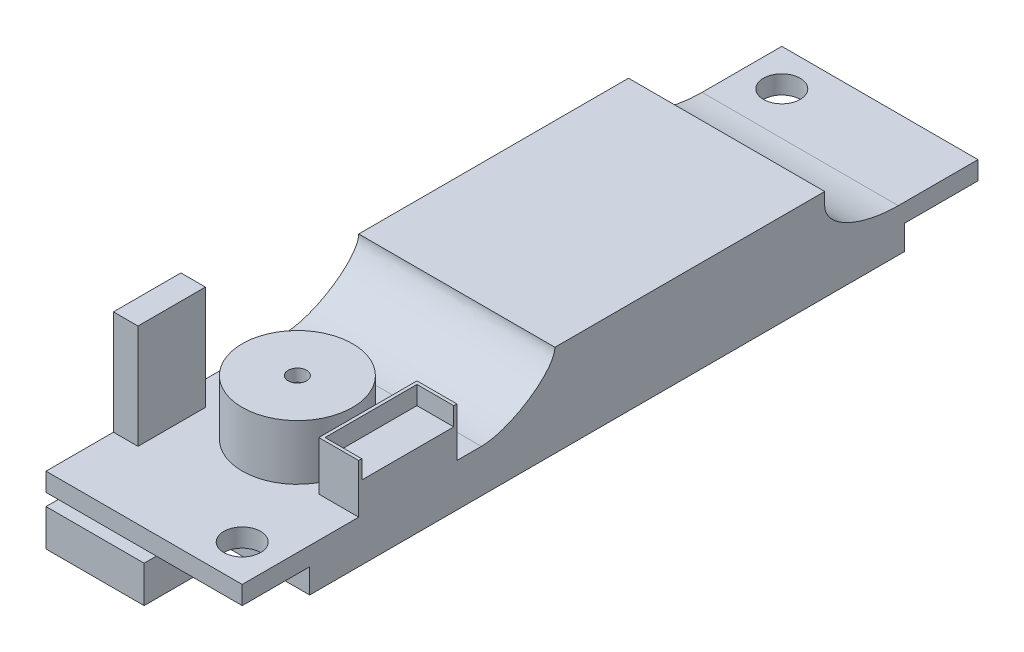
from build123d import *

# Parameters (mm, degrees)
SKETCH1_W           = 16
SKETCH1_H           = 60
BOSS_EXTRUDE1_DEPTH = 1.5
SKETCH5_R           = 1.5
CUT_EXTRUDE1_DEPTH  = 32.084562085
SKETCH8_W           = 16
SKETCH8_H           = 22
BOSS_EXTRUDE2_DEPTH = 4
FILLET1_START       = -8
FILLET1_DEPTH       = 16
FILLET2_START       = -8
FILLET2_DEPTH       = 16
SKETCH12_W          = 3.25
SKETCH12_H          = 8
BOSS_EXTRUDE5_DEPTH = 4
SKETCH15_R          = 4.5
BOSS_EXTRUDE6_DEPTH = 4.5
SKETCH16_W          = 3
SKETCH16_H          = 7.5
CUT_EXTRUDE2_DEPTH  = 1.5
SKETCH17_R          = 0.75
CUT_EXTRUDE3_DEPTH  = 1
SKETCH18_W          = 2
SKETCH18_H          = 5.5
BOSS_EXTRUDE7_DEPTH = 8.5
SKETCH22_W          = 8
SKETCH22_H          = 5.5
BOSS_EXTRUDE8_DEPTH = 3
SKETCH23_W          = 16
SKETCH23_H          = 48.5
BOSS_EXTRUDE9_DEPTH = 2


with BuildPart() as part:
    # Sketch1 → Boss-Extrude1 (new body)
    with BuildSketch(Plane(origin=(0, 0, 0), x_dir=(1, 0, 0), z_dir=(0, 1, 0))):
        Rectangle(SKETCH1_W, SKETCH1_H)
    extrude(amount=BOSS_EXTRUDE1_DEPTH)

    # Sketch5 → Cut-Extrude1 (cut, through all)
    with BuildSketch(Plane(origin=(0, 1.5, 0), x_dir=(1, 0, 0), z_dir=(0, 1, 0))):
        with Locations(Location((-5, 27, 0), (0, 0, 270))):
            Circle(SKETCH5_R)
        with Locations(Location((5, -27, 0), (0, 0, 270))):
            Circle(SKETCH5_R)
    extrude(amount=-CUT_EXTRUDE1_DEPTH, mode=Mode.SUBTRACT)

    # Sketch8 → Boss-Extrude2 (add)
    with BuildSketch(Plane(origin=(0, 1.5, 0), x_dir=(1, 0, 0), z_dir=(0, 1, 0))):
        with Locations((0, 6.5)):
            Rectangle(SKETCH8_W, SKETCH8_H)
    extrude(amount=BOSS_EXTRUDE2_DEPTH)

    # Fillet1: read off the stored shape, not the designer's step
    # Fillet1 outline → Fillet1 (add)
    with BuildSketch(Plane.YZ.offset(FILLET1_START)):
        with BuildLine():
            Line((1.5, -17.5), (1.5, -23.5))
            add(Edge.make_bspline(
                [(1.5, -23.5), (1.5, -17.5), (4.5, -17.5)],
                knots=[0, 0, 0, 1, 1, 1], degree=2, weights=[1, 0.666666667, 1]))
            Line((4.5, -17.5), (1.5, -17.5))
        make_face()
    extrude(amount=FILLET1_DEPTH)

    # Fillet2: read off the stored shape, not the designer's step
    # Fillet2 outline → Fillet2 (add)
    with BuildSketch(Plane.YZ.offset(FILLET2_START)):
        with BuildLine():
            Line((1.5, 4.5), (5.5, 4.5))
            add(Edge.make_bspline(
                [(5.5, 4.5), (1.5, 4.5), (1.5, 10.5)],
                knots=[0, 0, 0, 1, 1, 1], degree=2, weights=[1, 0.428571429, 1]))
            Line((1.5, 10.5), (1.5, 4.5))
        make_face()
    extrude(amount=FILLET2_DEPTH)

    # Sketch12 → Boss-Extrude5 (add)
    with BuildSketch(Plane(origin=(0, 1.5, 0), x_dir=(1, 0, 0), z_dir=(0, 1, 0))):
        with Locations((6.375, -16.5)):
            Rectangle(SKETCH12_W, SKETCH12_H)
    extrude(amount=BOSS_EXTRUDE5_DEPTH)

    # Sketch15 → Boss-Extrude6 (add)
    with BuildSketch(Plane(origin=(0, 1.5, 0), x_dir=(1, 0, 0), z_dir=(0, 1, 0))):
        with Locations(Location((0, -17.5, 0), (0, 0, 270))):
            Circle(SKETCH15_R)
    extrude(amount=BOSS_EXTRUDE6_DEPTH)

    # Sketch16 → Cut-Extrude2 (cut)
    with BuildSketch(Plane(origin=(0, 5.5, 0), x_dir=(1, 0, 0), z_dir=(0, 1, 0))):
        with Locations((6.5, -16.5)):
            Rectangle(SKETCH16_W, SKETCH16_H)
    extrude(amount=-CUT_EXTRUDE2_DEPTH, mode=Mode.SUBTRACT)

    # Sketch17 → Cut-Extrude3 (cut)
    with BuildSketch(Plane(origin=(0, 6, 0), x_dir=(1, 0, 0), z_dir=(0, 1, 0))):
        with Locations(Location((0, -17.5, 0), (0, 0, 270))):
            Circle(SKETCH17_R)
    extrude(amount=-CUT_EXTRUDE3_DEPTH, mode=Mode.SUBTRACT)

    # Sketch18 → Boss-Extrude7 (add)
    with BuildSketch(Plane(origin=(0, 1.5, 0), x_dir=(1, 0, 0), z_dir=(0, 1, 0))):
        with Locations((-7, -21.75)):
            Rectangle(SKETCH18_W, SKETCH18_H)
    extrude(amount=BOSS_EXTRUDE7_DEPTH)

    # Sketch22 → Boss-Extrude8 (add)
    with BuildSketch(Plane.XZ):
        with Locations((-3, 28.25)):
            Rectangle(SKETCH22_W, SKETCH22_H)
    extrude(amount=BOSS_EXTRUDE8_DEPTH)

    # Sketch23 → Boss-Extrude9 (add)
    with BuildSketch(Plane.XZ):
        with Locations((0, 0.25)):
            Rectangle(SKETCH23_W, SKETCH23_H)
    extrude(amount=BOSS_EXTRUDE9_DEPTH)


solid = part.part
